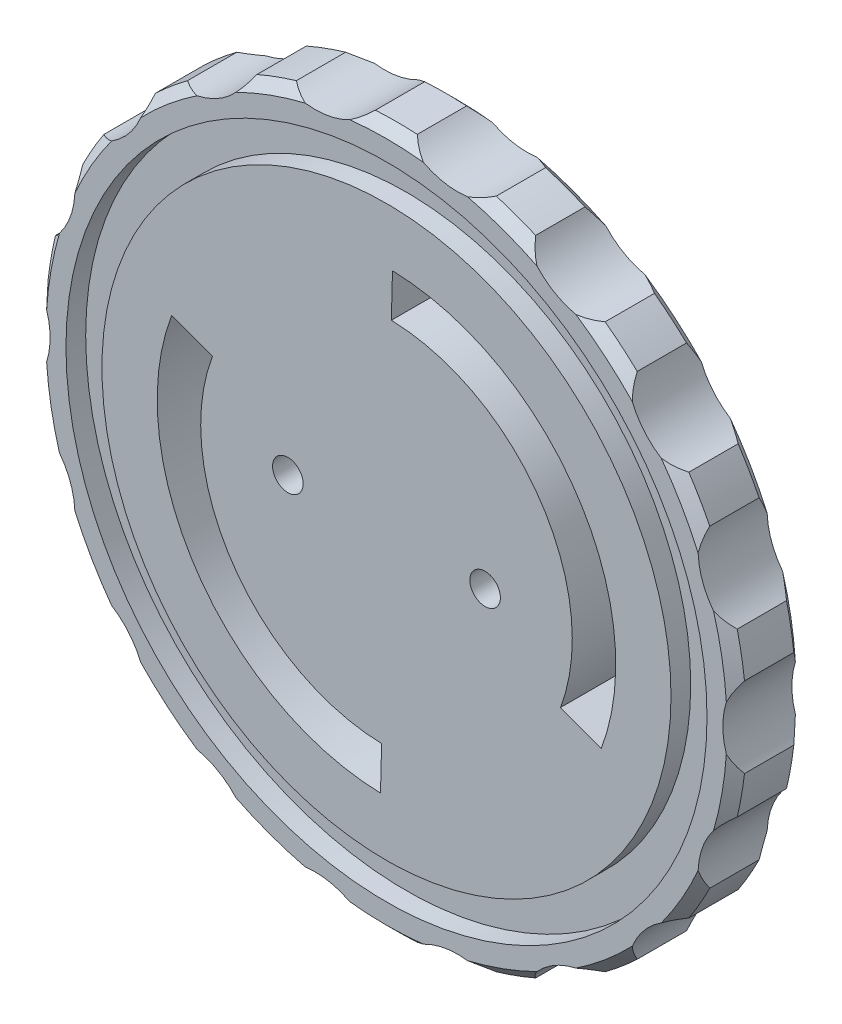
from build123d import *

# Parameters (mm, degrees)
SKETCH1_R           = 35.533616947
BOSS_EXTRUDE1_DEPTH = 7
SKETCH2_R           = 1.549932782
CUT_EXTRUDE1_DEPTH  = 7
SKETCH3_R           = 32.498513203
SKETCH3_R_2         = 28.848686357
CUT_EXTRUDE2_DEPTH  = 2
CHAMFER1_SIZE       = 1
SKETCH4_R           = 7.499245476
CUT_EXTRUDE3_DEPTH  = 7
CIRPATTERN1_DEPTH   = 7


# Read off the part's stored shape, not the designer's step: CirPattern1
with BuildPart() as part:
    # Sketch1 → Boss-Extrude1 (new body)
    with BuildSketch(Plane(origin=(0, 0, 0), x_dir=(-1, 0, 0), z_dir=(0, 0, -1))):
        Circle(SKETCH1_R)
        with BuildLine():
            Line((-21.773880267, -8.140928511), (-17.644959449, -6.597186707))
            ThreePointArc((-17.644959449, -6.597186707), (-15.617351539, 10.53403044), (-0.4931234, 18.831470885))
            Line((-0.4931234, 18.831470885), (-0.608514284, 23.2380354))
            ThreePointArc((-0.608514284, 23.2380354), (-19.271812071, 12.998993746), (-21.773880267, -8.140928511))
        make_face(mode=Mode.SUBTRACT)
        with BuildLine():
            Line((0.4931234, -18.831470885), (0.608514284, -23.238035402))
            ThreePointArc((0.608514284, -23.238035402), (19.271812072, -12.998993747), (21.773880268, 8.140928512))
            Line((21.773880268, 8.140928512), (17.644959449, 6.597186707))
            ThreePointArc((17.644959449, 6.597186707), (15.617351539, -10.53403044), (0.4931234, -18.831470885))
        make_face(mode=Mode.SUBTRACT)
    extrude(amount=-BOSS_EXTRUDE1_DEPTH)

    # Sketch2 → Cut-Extrude1 (cut)
    with BuildSketch(Plane.XY.offset(7)):
        with Locations((10.000004433, -7.6e-08)):
            Circle(SKETCH2_R)
        with Locations((-10.000004433, 7.6e-08)):
            Circle(SKETCH2_R)
    extrude(amount=-CUT_EXTRUDE1_DEPTH, mode=Mode.SUBTRACT)

    # Sketch3 → Cut-Extrude2 (cut)
    with BuildSketch(Plane.XY.offset(7)):
        Circle(SKETCH3_R)
        Circle(SKETCH3_R_2, mode=Mode.SUBTRACT)
    extrude(amount=-CUT_EXTRUDE2_DEPTH, mode=Mode.SUBTRACT)

    # Chamfer1
    chamfer1_edges = [part.edges().sort_by_distance(p)[0] for p in [
        (35.533616947, 0, 0),
        (35.533616947, 0, 7),
    ]]
    chamfer(chamfer1_edges, length=CHAMFER1_SIZE)

    # Sketch4 → Cut-Extrude3 (cut)
    with BuildSketch(Plane.XY.offset(7)):
        with Locations((-41.59956426, -3.41e-07)):
            Circle(SKETCH4_R)
    extrude(amount=-CUT_EXTRUDE3_DEPTH, mode=Mode.SUBTRACT)

    # CirPattern1 outline → CirPattern1 (cut)
    with BuildSketch(Plane.XY):
        with BuildLine():
            ThreePointArc((-24.426087895, 25.807056469), (-27.220329993, 22.840568479), (-29.656535263, 19.573651923))
            ThreePointArc((-29.656535263, 19.573651923), (-26.122359892, 21.919262187), (-24.426087895, 25.807056469))
        make_face()
        with BuildLine():
            ThreePointArc((-34.56261058, 8.250083833), (-32.043818023, 11.662995655), (-31.779547701, 15.896486443))
            ThreePointArc((-31.779547701, 15.896486443), (-33.390677735, 12.153212488), (-34.56261058, 8.250083833))
        make_face()
        with BuildLine():
            ThreePointArc((-34.562610445, -8.250084399), (-33.390677535, -12.153213035), (-31.779547441, -15.896486964))
            ThreePointArc((-31.779547441, -15.896486964), (-32.043817832, -11.66299618), (-34.562610445, -8.250084399))
        make_face()
        with BuildLine():
            ThreePointArc((-29.656534942, -19.573652408), (-27.220329003, -22.840569657), (-24.426086081, -25.807058183))
            ThreePointArc((-24.426086081, -25.807058183), (-26.122358737, -21.919263565), (-29.656534942, -19.573652408))
        make_face()
        with BuildLine():
            ThreePointArc((-21.17344364, -28.536349061), (-17.766808221, -30.773015109), (-14.126480864, -32.604914839))
            ThreePointArc((-14.126480864, -32.604914839), (-17.05015915, -29.531742484), (-21.17344364, -28.536349061))
        make_face()
        with BuildLine():
            ThreePointArc((-10.136522549, -34.057140865), (-6.170347542, -34.993781512), (-2.123012179, -35.470138885))
            ThreePointArc((-2.123012179, -35.470138885), (-5.921457939, -33.582258367), (-10.136522549, -34.057140865))
        make_face()
        with BuildLine():
            ThreePointArc((2.12301276, -35.470138851), (6.170348115, -34.99378141), (10.136523108, -34.057140698))
            ThreePointArc((10.136523108, -34.057140698), (5.92145849, -33.58225827), (2.12301276, -35.470138851))
        make_face()
        with BuildLine():
            ThreePointArc((14.126481398, -32.604914608), (17.766808725, -30.773014818), (21.173444108, -28.536348713))
            ThreePointArc((21.173444108, -28.536348713), (17.050159634, -29.531742204), (14.126481398, -32.604914608))
        make_face()
        with BuildLine():
            ThreePointArc((24.426087893, -25.807056467), (27.220329992, -22.840568478), (29.656535261, -19.573651923))
            ThreePointArc((29.656535261, -19.573651923), (26.122359892, -21.919262187), (24.426087893, -25.807056467))
        make_face()
        with BuildLine():
            ThreePointArc((31.779547701, -15.896486443), (33.390677734, -12.153212488), (34.562610579, -8.250083833))
            ThreePointArc((34.562610579, -8.250083833), (32.043818023, -11.662995655), (31.779547701, -15.896486443))
        make_face()
        with BuildLine():
            ThreePointArc((35.299925038, -4.068565547), (35.533616947, 2.91e-07), (35.299924972, 4.068566126))
            ThreePointArc((35.299924972, 4.068566126), (34.100318784, 2.8e-07), (35.299925038, -4.068565547))
        make_face()
        with BuildLine():
            ThreePointArc((34.562610445, 8.250084399), (33.390677536, 12.153213035), (31.779547441, 15.896486964))
            ThreePointArc((31.779547441, 15.896486964), (32.043817832, 11.66299618), (34.562610445, 8.250084399))
        make_face()
        with BuildLine():
            ThreePointArc((29.656534942, 19.573652408), (27.220329004, 22.840569658), (24.426086082, 25.807058184))
            ThreePointArc((24.426086082, 25.807058184), (26.122358737, 21.919263565), (29.656534942, 19.573652408))
        make_face()
        with BuildLine():
            ThreePointArc((21.173443641, 28.536349062), (17.766808222, 30.773015111), (14.126480865, 32.604914841))
            ThreePointArc((14.126480865, 32.604914841), (17.05015915, 29.531742484), (21.173443641, 28.536349062))
        make_face()
        with BuildLine():
            ThreePointArc((10.136522549, 34.057140867), (6.170347542, 34.993781514), (2.123012179, 35.470138888))
            ThreePointArc((2.123012179, 35.470138888), (5.921457939, 33.582258367), (10.136522549, 34.057140867))
        make_face()
        with BuildLine():
            ThreePointArc((-2.12301276, 35.470138853), (-6.170348116, 34.993781413), (-10.136523108, 34.057140701))
            ThreePointArc((-10.136523108, 34.057140701), (-5.92145849, 33.58225827), (-2.12301276, 35.470138853))
        make_face()
        with BuildLine():
            ThreePointArc((-14.126481398, 32.60491461), (-17.766808726, 30.77301482), (-21.173444109, 28.536348715))
            ThreePointArc((-21.173444109, 28.536348715), (-17.050159634, 29.531742204), (-14.126481398, 32.60491461))
        make_face()
    extrude(amount=CIRPATTERN1_DEPTH, mode=Mode.SUBTRACT)


solid = part.part
